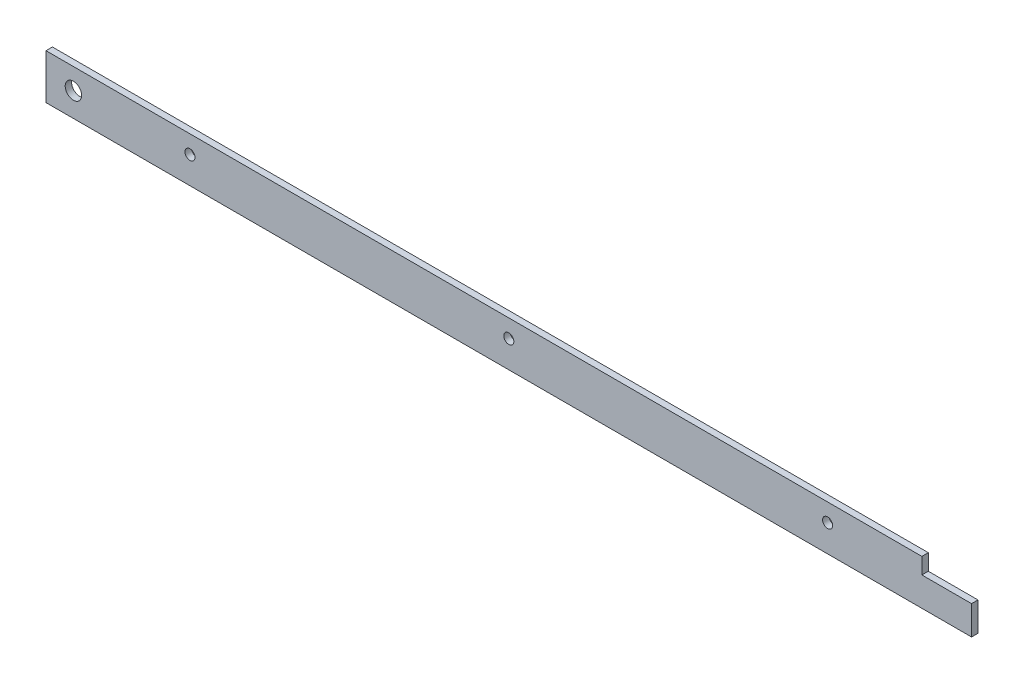
from build123d import *

# Parameters (mm, degrees)
SKETCH1_R           = 4.0635
SKETCH1_R_2         = 2.4892
BOSS_EXTRUDE1_DEPTH = 3.175


with BuildPart() as part:
    # Sketch1 → Boss-Extrude1 (new body)
    with BuildSketch(Plane.XY):
        Polygon((0, 17.391988029), (0, -4.833011971), (457.2, -4.833011971), (457.2, 9.446988029), (432.660000058, 9.446988029), (432.660000058, 17.391988029), (419.960000058, 17.391988029), align=None)
        with Locations((13.54, 7.026988029)):
            Circle(SKETCH1_R, mode=Mode.SUBTRACT)
        with Locations((71.12, 8.509488029)):
            Circle(SKETCH1_R_2, mode=Mode.SUBTRACT)
        with Locations((228.6, 8.509488029)):
            Circle(SKETCH1_R_2, mode=Mode.SUBTRACT)
        with Locations((386.08, 8.509488029)):
            Circle(SKETCH1_R_2, mode=Mode.SUBTRACT)
    extrude(amount=BOSS_EXTRUDE1_DEPTH)


solid = part.part
